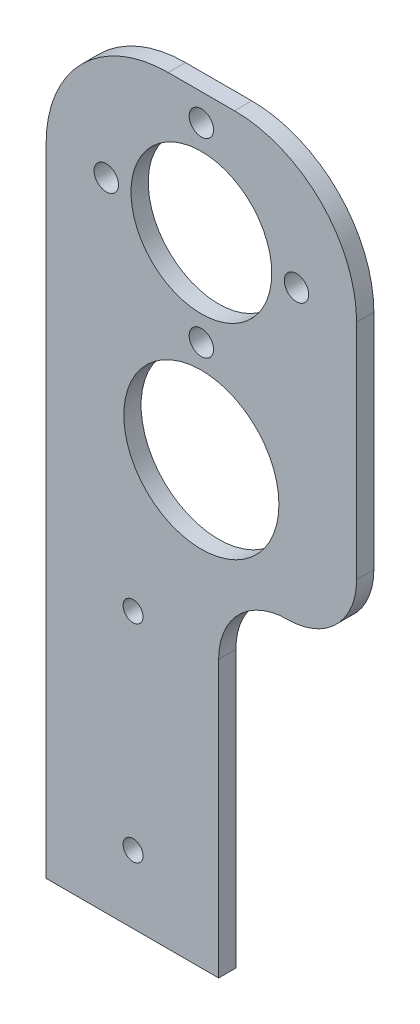
from build123d import *

# Parameters (mm, degrees)
SKETCH1_R           = 12.954
SKETCH1_R_2         = 2.25
SKETCH1_R_3         = 14.2748
SKETCH1_R_4         = 1.8415
BOSS_EXTRUDE1_DEPTH = 3.175
FILLET1_R           = 22.479
FILLET2_START       = -1
FILLET2_DEPTH       = 5
FILLET2_2_DEPTH     = 3.175


with BuildPart() as part:
    # Sketch1 → Boss-Extrude1 (new body)
    with BuildSketch(Plane.XY):
        Polygon((28.575, -20.461058414), (3.175, -20.461058414), (3.175, -83.961058414), (-28.575, -83.961058414), (-28.575, 55.738941586), (28.575, 55.738941586), align=None)
        with Locations((0, 33.259941586)):
            Circle(SKETCH1_R, mode=Mode.SUBTRACT)
        with Locations((0, 50.760541586)):
            Circle(SKETCH1_R_2, mode=Mode.SUBTRACT)
        with Locations((17.5006, 33.259941586)):
            Circle(SKETCH1_R_2, mode=Mode.SUBTRACT)
        with Locations((0, 15.759341586)):
            Circle(SKETCH1_R_2, mode=Mode.SUBTRACT)
        with Locations((-17.5006, 33.259941586)):
            Circle(SKETCH1_R_2, mode=Mode.SUBTRACT)
        with Locations((0, -2.935058414)):
            Circle(SKETCH1_R_3, mode=Mode.SUBTRACT)
        with Locations((-12.573, -33.351558414)):
            Circle(SKETCH1_R_4, mode=Mode.SUBTRACT)
        with Locations((-12.573, -71.451558414)):
            Circle(SKETCH1_R_4, mode=Mode.SUBTRACT)
    extrude(amount=BOSS_EXTRUDE1_DEPTH)

    # Fillet1
    fillet1_edges = [part.edges().sort_by_distance(p)[0] for p in [
        (-28.575, 55.738941586, 1.5875),
        (28.575, 55.738941586, 1.5875),
    ]]
    fillet(fillet1_edges, radius=FILLET1_R)

    # Fillet2: read off the stored shape, not the designer's step
    # Fillet2 outline → Fillet2 (cut)
    with BuildSketch(Plane.XY.offset(FILLET2_START)):
        with BuildLine():
            ThreePointArc((28.575, -7.761058414), (24.855256121, -16.741314535), (15.875, -20.461058414))
            Line((15.875, -20.461058414), (28.575, -20.461058414))
            Line((28.575, -20.461058414), (28.575, -7.761058414))
        make_face()
    extrude(amount=FILLET2_DEPTH, mode=Mode.SUBTRACT)

    # Fillet2 2 outline → Fillet2 2 (add)
    with BuildSketch(Plane.XY):
        with BuildLine():
            ThreePointArc((3.175, -33.161058414), (6.894743879, -24.180802293), (15.875, -20.461058414))
            Line((15.875, -20.461058414), (3.175, -20.461058414))
            Line((3.175, -20.461058414), (3.175, -33.161058414))
        make_face()
    extrude(amount=FILLET2_2_DEPTH)


solid = part.part
